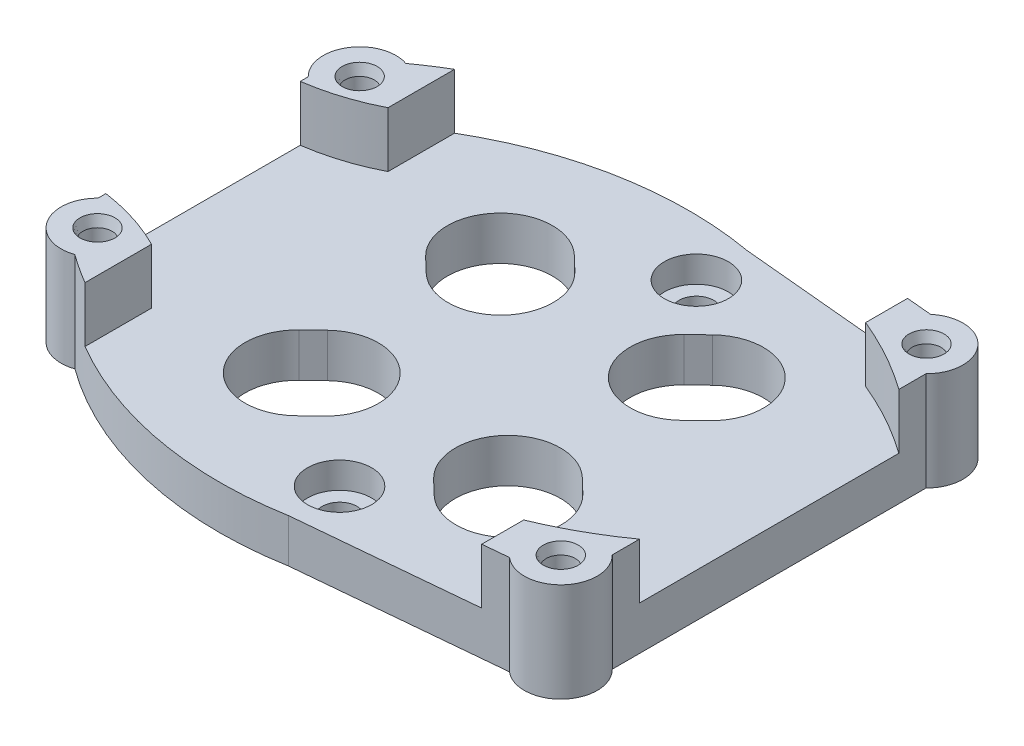
from build123d import *
from OCP.BRepFilletAPI import BRepFilletAPI_MakeChamfer

# Parameters (mm, degrees)
SKETCH1_R           = 1
BOSS_EXTRUDE1_DEPTH = 3
SKETCH1_5_R         = 1
BOSS_EXTRUDE2_DEPTH = 6.8
CUT_EXTRUDE1_DEPTH  = 7
SKETCH3_R           = 2
CUT_EXTRUDE2_DEPTH  = 1.8
MOVE_START          = 3
MOVE_FACE1_DEPTH    = 3.8
MOVE_FACE2_BY       = 0.2
MOVE_FACE2_2_BY     = 0.2
MOVE_FACE2_3_BY     = 0.2
MOVE_FACE2_4_BY     = 0.2
CHAMFER1_SIZE       = 0.7
CHAMFER1_SIZE2      = 0.2
CHAMFER2_SIZE       = 0.2
CHAMFER2_SIZE2      = 0.7


# Read off the part's stored shape, not the designer's step: Move Face1
with BuildPart() as part:
    # Sketch1 → Boss-Extrude1 (new body)
    with BuildSketch(Plane(origin=(0, 0, 0), x_dir=(1, 0, 0), z_dir=(0, 1, 0))):
        with BuildLine():
            Line((24.824168418, -41.434990566), (38.696876617, -40.141355505))
            ThreePointArc((38.696876617, -40.141355505), (42.164537627, -39.927592778), (42.070086822, -36.454633459))
            Line((42.070086822, -36.454633459), (42.070086822, -14.915347673))
            ThreePointArc((42.070086822, -14.915347673), (42.164537627, -11.442388354), (38.696876617, -11.228625627))
            Line((38.696876617, -11.228625627), (24.824168418, -9.934990566))
            ThreePointArc((24.824168418, -9.934990566), (14.849186159, -10.187088505), (5.767316865, -14.320304511))
            ThreePointArc((5.767316865, -14.320304511), (2.828547545, -15.371974531), (3.205984711, -18.470347673))
            Line((3.205984711, -18.470347673), (3.205984711, -32.899633459))
            ThreePointArc((3.205984711, -32.899633459), (2.828547545, -35.998006601), (5.767316865, -37.04967662))
            ThreePointArc((5.767316865, -37.04967662), (14.849186159, -41.182892626), (24.824168418, -41.434990566))
        make_face()
        with Locations(Location((4.955984711, -34.684990566, 0), (0, 0, 270))):
            Circle(SKETCH1_R, mode=Mode.SUBTRACT)
        with Locations(Location((24.824168418, -37.934990566, 0), (0, 0, 270))):
            Circle(SKETCH1_R, mode=Mode.SUBTRACT)
        with Locations(Location((40.320086822, -38.239990566, 0), (0, 0, 270))):
            Circle(SKETCH1_R, mode=Mode.SUBTRACT)
        with Locations(Location((4.955984711, -16.684990566, 0), (0, 0, 270))):
            Circle(SKETCH1_R, mode=Mode.SUBTRACT)
        with Locations(Location((24.824168418, -13.434990566, 0), (0, 0, 270))):
            Circle(SKETCH1_R, mode=Mode.SUBTRACT)
        with Locations(Location((40.320086822, -13.129990566, 0), (0, 0, 270))):
            Circle(SKETCH1_R, mode=Mode.SUBTRACT)
    extrude(amount=BOSS_EXTRUDE1_DEPTH)

    # Sketch1<5> → Boss-Extrude2 (add)
    # profile 1 of 8: a face of its own
    with BuildSketch(Plane(origin=(0, 0, 0), x_dir=(1, 0, 0), z_dir=(0, 1, 0))):
        with BuildLine():
            ThreePointArc((5.767316865, -37.04967662), (6.75947019, -37.734134037), (7.783460986, -38.369974447))
            Line((7.783460986, -38.369974447), (7.783460986, -33.244952788))
            ThreePointArc((7.783460986, -33.244952788), (6.373824255, -32.641654601), (4.909963227, -32.185414197))
            ThreePointArc((4.909963227, -32.185414197), (4.062798529, -31.99415486), (3.205984711, -31.852245597))
            Line((3.205984711, -31.852245597), (3.205984711, -32.899633459))
            Line((3.205984711, -32.899633459), (3.205984711, -34.684990566))
            ThreePointArc((3.205984711, -34.684990566), (3.718547844, -35.922427433), (4.955984711, -36.434990566))
            ThreePointArc((4.955984711, -36.434990566), (5.358522051, -36.746463253), (5.767316865, -37.04967662))
        make_face()
        with Locations(Location((4.955984711, -34.684990566, 0), (0, 0, 270))):
            Circle(SKETCH1_5_R, mode=Mode.SUBTRACT)
    # profile 2 of 8: a face of its own
    with BuildSketch(Plane(origin=(0, 0, 0), x_dir=(1, 0, 0), z_dir=(0, 1, 0))):
        with BuildLine():
            ThreePointArc((36.955984711, -14.488712586), (39.599003683, -15.793476237), (42.070086822, -17.400244917))
            Line((42.070086822, -17.400244917), (42.070086822, -14.915347673))
            Line((42.070086822, -14.915347673), (42.070086822, -13.129990566))
            ThreePointArc((42.070086822, -13.129990566), (41.557523689, -11.892553699), (40.320086822, -11.379990566))
            Line((40.320086822, -11.379990566), (38.696876617, -11.228625627))
            Line((38.696876617, -11.228625627), (36.955984711, -11.066286826))
            Line((36.955984711, -11.066286826), (36.955984711, -14.488712586))
        make_face()
        with Locations(Location((40.320086822, -13.129990566, 0), (0, 0, 270))):
            Circle(SKETCH1_5_R, mode=Mode.SUBTRACT)
    # profile 3 of 8: a face of its own
    with BuildSketch(Plane(origin=(0, 0, 0), x_dir=(1, 0, 0), z_dir=(0, 1, 0))):
        with BuildLine():
            Line((3.205984711, -18.470347673), (3.205984711, -19.517735535))
            ThreePointArc((3.205984711, -19.517735535), (5.55061073, -19.005071272), (7.783460986, -18.125028343))
            Line((7.783460986, -18.125028343), (7.783460986, -13.000006684))
            ThreePointArc((7.783460986, -13.000006684), (6.75947019, -13.635847094), (5.767316865, -14.320304511))
            ThreePointArc((5.767316865, -14.320304511), (5.358522051, -14.623517879), (4.955984711, -14.934990566))
            ThreePointArc((4.955984711, -14.934990566), (3.718547844, -15.447553699), (3.205984711, -16.684990566))
            Line((3.205984711, -16.684990566), (3.205984711, -18.470347673))
        make_face()
        with Locations(Location((4.955984711, -16.684990566, 0), (0, 0, 270))):
            Circle(SKETCH1_5_R, mode=Mode.SUBTRACT)
    # profile 4 of 8: a face of its own
    with BuildSketch(Plane(origin=(0, 0, 0), x_dir=(1, 0, 0), z_dir=(0, 1, 0))):
        with BuildLine():
            Line((36.955984711, -36.881268545), (36.955984711, -40.303694305))
            Line((36.955984711, -40.303694305), (38.696876617, -40.141355505))
            Line((38.696876617, -40.141355505), (40.320086822, -39.989990566))
            ThreePointArc((40.320086822, -39.989990566), (41.557523689, -39.477427433), (42.070086822, -38.239990566))
            Line((42.070086822, -38.239990566), (42.070086822, -36.454633459))
            Line((42.070086822, -36.454633459), (42.070086822, -33.969736214))
            ThreePointArc((42.070086822, -33.969736214), (39.599003683, -35.576504894), (36.955984711, -36.881268545))
        make_face()
        with Locations(Location((40.320086822, -38.239990566, 0), (0, 0, 270))):
            Circle(SKETCH1_5_R, mode=Mode.SUBTRACT)
    # profile 5 of 8: a face of its own
    with BuildSketch(Plane(origin=(0, 0, 0), x_dir=(1, 0, 0), z_dir=(0, 1, 0))):
        with BuildLine():
            ThreePointArc((5.767316865, -14.320304511), (2.828547545, -15.371974531), (3.205984711, -18.470347673))
            Line((3.205984711, -18.470347673), (3.205984711, -16.684990566))
            ThreePointArc((3.205984711, -16.684990566), (3.718547844, -15.447553699), (4.955984711, -14.934990566))
            ThreePointArc((4.955984711, -14.934990566), (5.358522051, -14.623517879), (5.767316865, -14.320304511))
        make_face()
    # profile 6 of 8: a face of its own
    with BuildSketch(Plane(origin=(0, 0, 0), x_dir=(1, 0, 0), z_dir=(0, 1, 0))):
        with BuildLine():
            ThreePointArc((3.205984711, -32.899633459), (2.828547545, -35.998006601), (5.767316865, -37.04967662))
            ThreePointArc((5.767316865, -37.04967662), (5.358522051, -36.746463253), (4.955984711, -36.434990566))
            ThreePointArc((4.955984711, -36.434990566), (3.718547844, -35.922427433), (3.205984711, -34.684990566))
            Line((3.205984711, -34.684990566), (3.205984711, -32.899633459))
        make_face()
    # profile 7 of 8: a face of its own
    with BuildSketch(Plane(origin=(0, 0, 0), x_dir=(1, 0, 0), z_dir=(0, 1, 0))):
        with BuildLine():
            Line((42.070086822, -13.129990566), (42.070086822, -14.915347673))
            ThreePointArc((42.070086822, -14.915347673), (42.164537627, -11.442388354), (38.696876617, -11.228625627))
            Line((38.696876617, -11.228625627), (40.320086822, -11.379990566))
            ThreePointArc((40.320086822, -11.379990566), (41.557523689, -11.892553699), (42.070086822, -13.129990566))
        make_face()
    # profile 8 of 8: a face of its own
    with BuildSketch(Plane(origin=(0, 0, 0), x_dir=(1, 0, 0), z_dir=(0, 1, 0))):
        with BuildLine():
            Line((40.320086822, -39.989990566), (38.696876617, -40.141355505))
            ThreePointArc((38.696876617, -40.141355505), (42.164537627, -39.927592778), (42.070086822, -36.454633459))
            Line((42.070086822, -36.454633459), (42.070086822, -38.239990566))
            ThreePointArc((42.070086822, -38.239990566), (41.557523689, -39.477427433), (40.320086822, -39.989990566))
        make_face()
    extrude(amount=BOSS_EXTRUDE2_DEPTH)

    # Sketch2 → Cut-Extrude1 (cut)
    # profile 1 of 7: a face of its own
    with BuildSketch(Plane(origin=(0, 3, 0), x_dir=(1, 0, 0), z_dir=(0, 1, 0))):
        with BuildLine():
            Line((15.133035567, -22.292628664), (14.144339339, -21.344272313))
            ThreePointArc((14.144339339, -21.344272313), (14.038042286, -16.240068072), (19.142246528, -16.13377102))
            Line((19.142246528, -16.13377102), (20.130942756, -17.08212737))
            ThreePointArc((20.130942756, -17.08212737), (20.237239809, -22.186331611), (15.133035567, -22.292628664))
        make_face()
        with BuildLine():
            ThreePointArc((17.757784702, -17.577123179), (15.481394445, -17.624529897), (15.528801164, -19.900920155))
            Line((15.528801164, -19.900920155), (16.517497393, -20.849276505))
            ThreePointArc((16.517497393, -20.849276505), (18.79388765, -20.801869786), (18.746480931, -18.525479529))
            Line((18.746480931, -18.525479529), (17.757784702, -17.577123179))
        make_face(mode=Mode.SUBTRACT)
    # profile 2 of 7: a face of its own
    with BuildSketch(Plane(origin=(0, 3, 0), x_dir=(1, 0, 0), z_dir=(0, 1, 0))):
        with BuildLine():
            ThreePointArc((32.636404248, -22.292628664), (27.532200006, -22.186331611), (27.638497059, -17.08212737))
            Line((27.638497059, -17.08212737), (28.627193287, -16.13377102))
            ThreePointArc((28.627193287, -16.13377102), (33.731397529, -16.240068072), (33.625100476, -21.344272313))
            Line((33.625100476, -21.344272313), (32.636404248, -22.292628664))
        make_face()
        with BuildLine():
            Line((29.022958884, -18.525479529), (30.011655113, -17.577123179))
            ThreePointArc((30.011655113, -17.577123179), (32.28804537, -17.624529897), (32.240638651, -19.900920155))
            Line((32.240638651, -19.900920155), (31.251942422, -20.849276505))
            ThreePointArc((31.251942422, -20.849276505), (28.975552165, -20.801869786), (29.022958884, -18.525479529))
        make_face(mode=Mode.SUBTRACT)
    # profile 3 of 7: a face of its own
    with BuildSketch(Plane(origin=(0, 3, 0), x_dir=(1, 0, 0), z_dir=(0, 1, 0))):
        with BuildLine():
            ThreePointArc((30.011655113, -17.577123179), (32.28804537, -17.624529897), (32.240638651, -19.900920155))
            Line((32.240638651, -19.900920155), (31.251942422, -20.849276505))
            ThreePointArc((31.251942422, -20.849276505), (28.975552165, -20.801869786), (29.022958884, -18.525479529))
            Line((29.022958884, -18.525479529), (30.011655113, -17.577123179))
        make_face()
    # profile 4 of 7: a face of its own
    with BuildSketch(Plane(origin=(0, 3, 0), x_dir=(1, 0, 0), z_dir=(0, 1, 0))):
        with BuildLine():
            ThreePointArc((33.623989066, -30.028201915), (33.728979595, -35.132433198), (28.624748312, -35.237423727))
            Line((28.624748312, -35.237423727), (27.636294866, -34.288814332))
            ThreePointArc((27.636294866, -34.288814332), (27.531304337, -29.184583049), (32.63553562, -29.07959252))
            Line((32.63553562, -29.07959252), (33.623989066, -30.028201915))
        make_face()
        with BuildLine():
            Line((30.009579546, -33.794425995), (29.0211261, -32.8458166))
            ThreePointArc((29.0211261, -32.8458166), (28.974302069, -30.569414283), (31.250704386, -30.522590252))
            Line((31.250704386, -30.522590252), (32.239157832, -31.471199647))
            ThreePointArc((32.239157832, -31.471199647), (32.285981863, -33.747601964), (30.009579546, -33.794425995))
        make_face(mode=Mode.SUBTRACT)
    # profile 5 of 7: a face of its own
    with BuildSketch(Plane(origin=(0, 3, 0), x_dir=(1, 0, 0), z_dir=(0, 1, 0))):
        with BuildLine():
            ThreePointArc((29.0211261, -32.8458166), (28.974302069, -30.569414283), (31.250704386, -30.522590252))
            Line((31.250704386, -30.522590252), (32.239157832, -31.471199647))
            ThreePointArc((32.239157832, -31.471199647), (32.285981863, -33.747601964), (30.009579546, -33.794425995))
            Line((30.009579546, -33.794425995), (29.0211261, -32.8458166))
        make_face()
    # profile 6 of 7: a face of its own
    with BuildSketch(Plane(origin=(0, 3, 0), x_dir=(1, 0, 0), z_dir=(0, 1, 0))):
        with BuildLine():
            Line((14.145450749, -30.028201915), (15.133904195, -29.07959252))
            ThreePointArc((15.133904195, -29.07959252), (20.238135478, -29.184583049), (20.133144949, -34.288814332))
            Line((20.133144949, -34.288814332), (19.144691503, -35.237423727))
            ThreePointArc((19.144691503, -35.237423727), (14.04046022, -35.132433198), (14.145450749, -30.028201915))
        make_face()
        with BuildLine():
            ThreePointArc((18.748313715, -32.8458166), (18.795137746, -30.569414283), (16.518735429, -30.522590252))
            Line((16.518735429, -30.522590252), (15.530281983, -31.471199647))
            ThreePointArc((15.530281983, -31.471199647), (15.483457952, -33.747601964), (17.759860269, -33.794425995))
            Line((17.759860269, -33.794425995), (18.748313715, -32.8458166))
        make_face(mode=Mode.SUBTRACT)
    # profile 7 of 7: a face of its own
    with BuildSketch(Plane(origin=(0, 3, 0), x_dir=(1, 0, 0), z_dir=(0, 1, 0))):
        with BuildLine():
            Line((17.759860269, -33.794425995), (18.748313715, -32.8458166))
            ThreePointArc((18.748313715, -32.8458166), (18.795137746, -30.569414283), (16.518735429, -30.522590252))
            Line((16.518735429, -30.522590252), (15.530281983, -31.471199647))
            ThreePointArc((15.530281983, -31.471199647), (15.483457952, -33.747601964), (17.759860269, -33.794425995))
        make_face()
    extrude(amount=-CUT_EXTRUDE1_DEPTH, mode=Mode.SUBTRACT)


with BuildPart() as cut_extrude1_kept_piece:
    # of the separate pieces the step leaves, the one the design keeps (cut_extrude1_pieces_kept)
    add(part.part.solids().sort_by_distance((24.824168418, 0, 41.434990566))[0])

    # Sketch3 → Cut-Extrude2 (cut)
    with BuildSketch(Plane(origin=(0, 3, 0), x_dir=(1, 0, 0), z_dir=(0, 1, 0))):
        with Locations(Location((24.824168418, -13.434990566, 0), (0, 0, 270))):
            Circle(SKETCH3_R)
        with Locations(Location((24.824168418, -37.934990566, 0), (0, 0, 270))):
            Circle(SKETCH3_R)
    extrude(amount=-CUT_EXTRUDE2_DEPTH, mode=Mode.SUBTRACT)

    # Move Face1 outline → Move Face1 (cut)
    with BuildSketch(Plane(origin=(0, 0, 0), x_dir=(1, 0, 0), z_dir=(0, 1, 0)).offset(MOVE_START)):
        with BuildLine():
            Line((7.783460986, -18.125028343), (7.783460986, -17.565930728))
            ThreePointArc((7.783460986, -17.565930728), (5.555025764, -18.48020931), (3.205984711, -19.012970982))
            Line((3.205984711, -19.012970982), (3.205984711, -19.517735535))
            ThreePointArc((3.205984711, -19.517735535), (5.550610731, -19.005071272), (7.783460986, -18.125028343))
        make_face()
        with BuildLine():
            ThreePointArc((7.783460986, -33.244952788), (5.550610731, -32.364909859), (3.205984711, -31.852245597))
            Line((3.205984711, -31.852245597), (3.205984711, -32.357010149))
            ThreePointArc((3.205984711, -32.357010149), (5.555025764, -32.889771821), (7.783460986, -33.804050403))
            Line((7.783460986, -33.804050403), (7.783460986, -33.244952788))
        make_face()
        with BuildLine():
            Line((42.070086822, -34.587758113), (42.070086822, -33.969736214))
            ThreePointArc((42.070086822, -33.969736214), (39.599003683, -35.576504894), (36.955984711, -36.881268545))
            Line((36.955984711, -36.881268545), (36.955984711, -37.423079034))
            ThreePointArc((36.955984711, -37.423079034), (39.594576687, -36.152494903), (42.070086822, -34.587758113))
        make_face()
        with BuildLine():
            ThreePointArc((42.070086822, -16.782223018), (39.594576687, -15.217486228), (36.955984711, -13.946902097))
            Line((36.955984711, -13.946902097), (36.955984711, -14.488712586))
            ThreePointArc((36.955984711, -14.488712586), (39.599003683, -15.793476237), (42.070086822, -17.400244917))
            Line((42.070086822, -17.400244917), (42.070086822, -16.782223018))
        make_face()
    extrude(amount=MOVE_FACE1_DEPTH, mode=Mode.SUBTRACT)

    # Move Face2: a curved face moved inward by 0.2
    add(Solid.thicken(cut_extrude1_kept_piece.faces().sort_by_distance((24.824168418, 2.1, 11.434990566))[0], -MOVE_FACE2_BY), mode=Mode.SUBTRACT)

    # Move Face2 2: a curved face moved inward by 0.2
    add(Solid.thicken(cut_extrude1_kept_piece.faces().sort_by_distance((24.824168418, 2.1, 35.934990566))[0], -MOVE_FACE2_2_BY), mode=Mode.SUBTRACT)

    # Move Face2 3: a curved face moved inward by 0.2
    add(Solid.thicken(cut_extrude1_kept_piece.faces().sort_by_distance((24.824168418, 0.6, 12.434990566))[0], -MOVE_FACE2_3_BY), mode=Mode.SUBTRACT)

    # Move Face2 4: a curved face moved inward by 0.2
    add(Solid.thicken(cut_extrude1_kept_piece.faces().sort_by_distance((24.824168418, 0.6, 36.934990566))[0], -MOVE_FACE2_4_BY), mode=Mode.SUBTRACT)

    # Chamfer1: one chamfer whose edges measure the first distance from different faces: ONE call of the kernel's chamfer builder (chamfer() names one face for all edges)
    chamfer1_edges_1 = [cut_extrude1_kept_piece.edges().sort_by_distance(p)[0] for p in [
        (40.320086822, 6.8, 12.129990566),
    ]]
    chamfer1_side_1 = [cut_extrude1_kept_piece.faces().sort_by_distance(p)[0] for p in [
        (40.320086822, 3.4, 12.129990566),
    ]]
    chamfer1_edges_2 = [cut_extrude1_kept_piece.edges().sort_by_distance(p)[0] for p in [
        (4.955984711, 6.8, 15.684990566),
    ]]
    chamfer1_side_2 = [cut_extrude1_kept_piece.faces().sort_by_distance(p)[0] for p in [
        (4.955984711, 3.4, 15.684990566),
    ]]
    chamfer1 = BRepFilletAPI_MakeChamfer(cut_extrude1_kept_piece.part.solid().wrapped)
    for e in chamfer1_edges_1:
        chamfer1.Add(CHAMFER1_SIZE, CHAMFER1_SIZE2, e.wrapped, chamfer1_side_1[0].wrapped)  # the first distance lies on this face
    for e in chamfer1_edges_2:
        chamfer1.Add(CHAMFER1_SIZE, CHAMFER1_SIZE2, e.wrapped, chamfer1_side_2[0].wrapped)  # the first distance lies on this face
    add(Compound.cast(chamfer1.Shape()), mode=Mode.REPLACE)

    # Chamfer2: one chamfer whose edges measure the first distance from different faces: ONE call of the kernel's chamfer builder (chamfer() names one face for all edges)
    chamfer2_edges_1 = [cut_extrude1_kept_piece.edges().sort_by_distance(p)[0] for p in [
        (40.320086822, 6.8, 37.239990566),
    ]]
    chamfer2_side_1 = [cut_extrude1_kept_piece.faces().sort_by_distance(p)[0] for p in [
        (41.985094082, 6.8, 35.521195786),
    ]]
    chamfer2_edges_2 = [cut_extrude1_kept_piece.edges().sort_by_distance(p)[0] for p in [
        (4.955984711, 6.8, 33.684990566),
    ]]
    chamfer2_side_2 = [cut_extrude1_kept_piece.faces().sort_by_distance(p)[0] for p in [
        (3.286320097, 6.8, 32.628321804),
    ]]
    chamfer2 = BRepFilletAPI_MakeChamfer(cut_extrude1_kept_piece.part.solid().wrapped)
    for e in chamfer2_edges_1:
        chamfer2.Add(CHAMFER2_SIZE, CHAMFER2_SIZE2, e.wrapped, chamfer2_side_1[0].wrapped)  # the first distance lies on this face
    for e in chamfer2_edges_2:
        chamfer2.Add(CHAMFER2_SIZE, CHAMFER2_SIZE2, e.wrapped, chamfer2_side_2[0].wrapped)  # the first distance lies on this face
    add(Compound.cast(chamfer2.Shape()), mode=Mode.REPLACE)


solid = cut_extrude1_kept_piece.part
